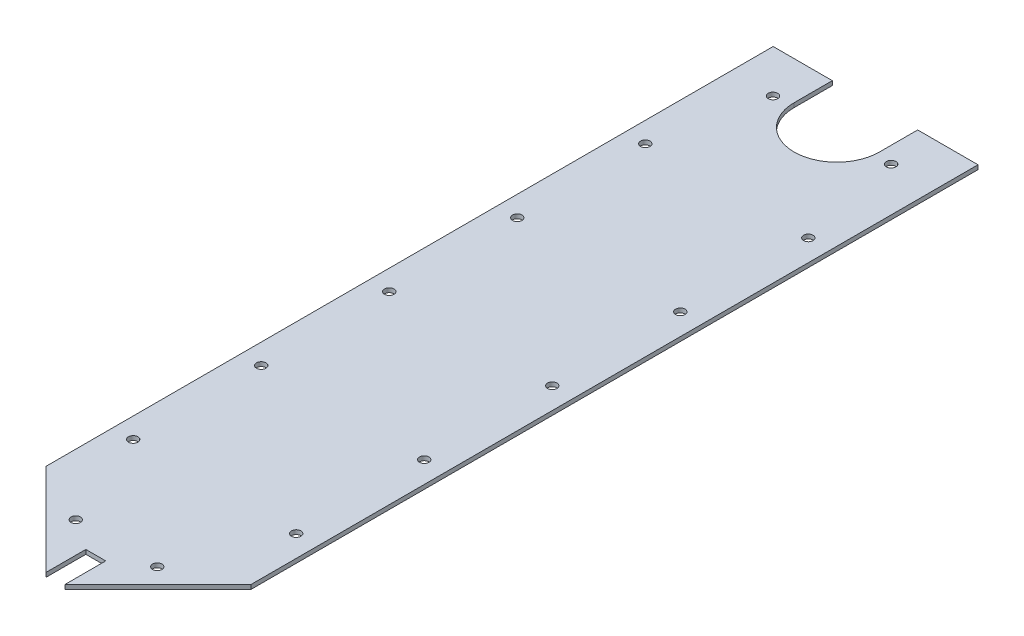
from build123d import *

# Parameters (mm, degrees)
BOSS_EXTRUDE2_DEPTH     = 3
CUT_EXTRUDE1_DEPTH      = 301.665110986
CUT_EXTRUDE2_DEPTH      = 301.665110986
CUT_EXTRUDE2_DEPTH_BACK = 301.665110986
SKETCH5_R               = 3.325


with BuildPart() as part:
    # Sketch3 → Boss-Extrude2 (new body)
    with BuildSketch(Plane(origin=(0, 0, 0), x_dir=(1, 0, 0), z_dir=(0, 1, 0))):
        with BuildLine():
            Line((-71.592001125, 291.800526166), (-30.005764519, 291.800526166))
            Line((-30.005764519, 291.800526166), (-30.005764519, 264.934819646))
            ThreePointArc((-30.005764519, 264.934819646), (0, 234.929055126), (30.005764519, 264.934819646))
            Line((30.005764519, 264.934819646), (30.005764519, 291.800526166))
            Line((30.005764519, 291.800526166), (72.408299895, 291.800526166))
            Line((72.408299895, 291.800526166), (72.408299895, -219.373421964))
            Line((72.408299895, -219.373421964), (0.408149385, -291.373572474))
            Line((0.408149385, -291.373572474), (-71.592001125, -219.373421964))
            Line((-71.592001125, -219.373421964), (-71.592001125, 291.800526166))
        make_face()
    extrude(amount=BOSS_EXTRUDE2_DEPTH)

    # Sketch4 → Cut-Extrude1 (cut, through all)
    with BuildSketch(Plane(origin=(0, 3, 0), x_dir=(1, 0, 0), z_dir=(0, 1, 0))):
        Polygon((-7, -283.965423089), (-7, -255.965423089), (7, -255.965423089), (7, -284.781721859), (0.408149385, -291.373572474), align=None)
    extrude(amount=-CUT_EXTRUDE1_DEPTH, mode=Mode.SUBTRACT)

    # Sketch5 → Cut-Extrude2 (cut, two sides: drawn at the far end of the back side and taken through both)
    with BuildSketch(Plane(origin=(0, 3, 0), x_dir=(1, 0, 0), z_dir=(0, 1, 0)).offset(-CUT_EXTRUDE2_DEPTH_BACK)):
        with Locations((-28.65007526, -241.415105099)):
            Circle(SKETCH5_R)
        with Locations((-57.30015051, -172.372698109)):
            Circle(SKETCH5_R)
        with Locations((-57.30015051, -82.372698109)):
            Circle(SKETCH5_R)
        with Locations((-57.30015051, 7.627301891)):
            Circle(SKETCH5_R)
        with Locations((-57.30015051, 97.627301891)):
            Circle(SKETCH5_R)
        with Locations((-57.30015051, 187.627301891)):
            Circle(SKETCH5_R)
        with Locations((57.30015051, 187.627301891)):
            Circle(SKETCH5_R)
        with Locations((57.30015051, 97.627301891)):
            Circle(SKETCH5_R)
        with Locations((57.30015051, -82.372698109)):
            Circle(SKETCH5_R)
        with Locations((57.30015051, -172.372698109)):
            Circle(SKETCH5_R)
        with Locations((57.30015051, 7.627301891)):
            Circle(SKETCH5_R)
        with Locations((28.65007526, -241.415105099)):
            Circle(SKETCH5_R)
        with Locations((41.537257894, 261.609819636)):
            Circle(SKETCH5_R)
        with Locations((-41.537257894, 261.609819636)):
            Circle(SKETCH5_R)
    extrude(amount=CUT_EXTRUDE2_DEPTH + CUT_EXTRUDE2_DEPTH_BACK, mode=Mode.SUBTRACT)


solid = part.part
